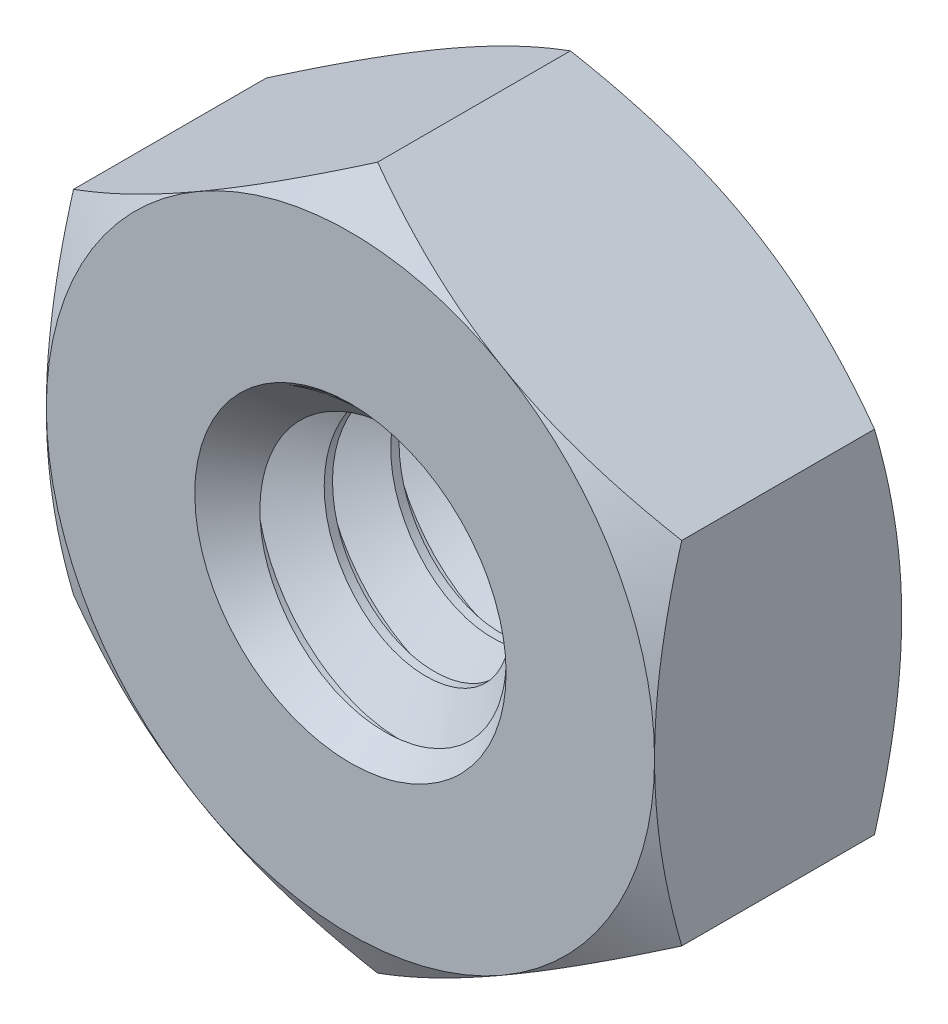
from build123d import *

# Parameters (mm, degrees)
BOSS_EXTRUDE1_DEPTH      = 0.65
BOSS_EXTRUDE1_DEPTH_BACK = 0.65
SKETCH2_R                = 0.8
SKETCH3_OUTSIDE_W        = 19.266
SKETCH3_OUTSIDE_H        = 19.762
SKETCH3_OUTSIDE_R        = 1.6
CUT_EXTRUDE1_DEPTH       = 3.768272626
CUT_EXTRUDE1_DRAFT       = -60
MIRROR1_COPY_1_SKETCH_W  = 19.266
MIRROR1_COPY_1_SKETCH_H  = 19.762
MIRROR1_COPY_1_SKETCH_R  = 1.6
MIRROR1_COPY_1_DEPTH     = 3.768272626
MIRROR1_COPY_1_DRAFT     = -60
SWEEP1_PITCH             = 0.35
SKETCH6_R                = 0.818944306
CUT_EXTRUDE2_DEPTH       = 3.955003784
SKETCH7_R                = 0.818944306
CUT_EXTRUDE3_DEPTH       = 3.768272731


with BuildPart() as part:
    # Sketch2 → Boss-Extrude1 (new, two sides: drawn at the far end of the back side and taken through both)
    with BuildSketch(Plane.XY.offset(-BOSS_EXTRUDE1_DEPTH_BACK)):
        Polygon((0, 1.847520861), (-1.6, 0.923760431), (-1.6, -0.923760431), (0, -1.847520861), (1.6, -0.923760431), (1.6, 0.923760431), align=None)
        Circle(SKETCH2_R, mode=Mode.SUBTRACT)
    extrude(amount=BOSS_EXTRUDE1_DEPTH + BOSS_EXTRUDE1_DEPTH_BACK)


with BuildPart() as cut_extrude1_tool:
    # Sketch3 outside → Cut-Extrude1 (with draft: the straight prism first)
    with BuildSketch(Plane.XY.offset(0.65)):
        Rectangle(SKETCH3_OUTSIDE_W, SKETCH3_OUTSIDE_H)
        Circle(SKETCH3_OUTSIDE_R, mode=Mode.SUBTRACT)
    extrude(amount=-CUT_EXTRUDE1_DEPTH)
    # Cut-Extrude1: the draft: its side faces are tilted about the plane it starts from
    cut_extrude1_sides = [cut_extrude1_tool.faces().sort_by_distance(p)[0] for p in [
        (0, -9.881, -1.234136313),
        (9.633, 0, -1.234136313),
        (0, 9.881, -1.234136313),
        (-9.633, 0, -1.234136313),
        (-1.6, 0, -1.234136313),
    ]]
    draft(cut_extrude1_sides, Plane.XY.offset(0.65), CUT_EXTRUDE1_DRAFT)


with BuildPart() as part_1:
    add(part.part)

    # Cut-Extrude1: cut by cut_extrude1_tool
    add(cut_extrude1_tool.part, mode=Mode.SUBTRACT)


with BuildPart() as mirror1_copy_1_tool:
    # Mirror1 copy 1 sketch → Mirror1 copy 1 (with draft: the straight prism first)
    with BuildSketch(Plane(origin=(0, 0, -0.65), x_dir=(1, 0, 0), z_dir=(0, 0, -1))):
        Rectangle(MIRROR1_COPY_1_SKETCH_W, MIRROR1_COPY_1_SKETCH_H)
        Circle(MIRROR1_COPY_1_SKETCH_R, mode=Mode.SUBTRACT)
    extrude(amount=-MIRROR1_COPY_1_DEPTH)
    # Mirror1 copy 1: the draft: its side faces are tilted about the plane it starts from
    mirror1_copy_1_sides = [mirror1_copy_1_tool.faces().sort_by_distance(p)[0] for p in [
        (0, -9.881, 1.234136313),
        (9.633, 0, 1.234136313),
        (0, 9.881, 1.234136313),
        (-9.633, 0, 1.234136313),
        (-1.6, 0, 1.234136313),
    ]]
    draft(mirror1_copy_1_sides, Plane(origin=(0, 0, -0.65), x_dir=(1, 0, 0), z_dir=(0, 0, -1)), MIRROR1_COPY_1_DRAFT)


with BuildPart() as part_2:
    add(part_1.part)

    # Mirror1 copy 1: cut by mirror1_copy_1_tool
    add(mirror1_copy_1_tool.part, mode=Mode.SUBTRACT)

    # Sweep1: the profile of Sketch4 screwed along a right-hand helix of 4.714286 turns, 6 arcs to a turn; built about Z, then put on its axis
    sweep1_z = Axis((0, 0, 0), (0, 0, 1))
    sweep1_corners = [(0.818944306, 0, -0.3171875), (0.572668332, 0, -0.175), (0.572668332, 0, -0.13125), (0.818944306, 0, 0.0109375)]
    with BuildLine(mode=Mode.PRIVATE) as sweep1_profile:
        Line(sweep1_corners[0], sweep1_corners[1])
        Line(sweep1_corners[1], sweep1_corners[2])
        Line(sweep1_corners[2], sweep1_corners[3])
        Line(sweep1_corners[3], sweep1_corners[0])
    sweep1_cap = Face(sweep1_profile.wire())
    sweep1_turn_angles = [0, 30, 60, 90, 120, 150, 180, 210, 240, 270, 300, 330, 360]
    sweep1_turn_weights = [1, 0.8660254037844387, 1, 0.8660254037844387, 1, 0.8660254037844387, 1, 0.8660254037844387, 1, 0.8660254037844387, 1, 0.8660254037844387, 1]
    sweep1_turn_rails = [Edge.make_bspline([Vector(p[0], p[1], 0).rotate(sweep1_z, sweep1_turn_angles[k]) / sweep1_turn_weights[k] + Vector(0, 0, p[2] + SWEEP1_PITCH * sweep1_turn_angles[k] / 360) for k in range(13)], [0, 0, 0, 1, 1, 2, 2, 3, 3, 4, 4, 5, 5, 6, 6, 6], 2, sweep1_turn_weights) for p in sweep1_corners]
    sweep1_turn_sides = [Face.make_surface_from_curves(sweep1_turn_rails[p[0]], sweep1_turn_rails[p[1]]) for p in [(0, 1), (1, 2), (2, 3), (3, 0)]]
    sweep1_last_angles = [1440, 1470, 1500, 1530, 1560, 1590, 1620, 1650, 1680, 1688.571428571, 1697.142857143]
    sweep1_last_weights = [1, 0.8660254037844387, 1, 0.8660254037844387, 1, 0.8660254037844387, 1, 0.8660254037844387, 1, 0.9888308262251224, 1]
    sweep1_last_rails = [Edge.make_bspline([Vector(p[0], p[1], 0).rotate(sweep1_z, sweep1_last_angles[k]) / sweep1_last_weights[k] + Vector(0, 0, p[2] + SWEEP1_PITCH * sweep1_last_angles[k] / 360) for k in range(11)], [0, 0, 0, 1, 1, 2, 2, 3, 3, 4, 4, 5, 5, 5], 2, sweep1_last_weights) for p in sweep1_corners]
    sweep1_last_sides = [Face.make_surface_from_curves(sweep1_last_rails[p[0]], sweep1_last_rails[p[1]]) for p in [(0, 1), (1, 2), (2, 3), (3, 0)]]
    sweep1 = Plane(origin=(0, 0, 0.65), x_dir=(0, 1, 0), z_dir=(0, 0, -1)) * Solid(Shell([*[p.moved(Location((0, 0, SWEEP1_PITCH * i))) for i in range(4) for p in sweep1_turn_sides], *sweep1_last_sides, sweep1_cap, sweep1_cap.rotate(sweep1_z, 1697.142857143).moved(Location((0, 0, SWEEP1_PITCH * 1697.142857143 / 360)))]))
    add(sweep1)

    # Sketch6 → Cut-Extrude2 (cut)
    with BuildSketch(Plane.XY.offset(0.65)):
        Circle(SKETCH6_R)
    extrude(amount=CUT_EXTRUDE2_DEPTH, mode=Mode.SUBTRACT)

    # Cut-Extrude2 cone 1 section (through the dimple's axis) → Cut-Extrude2 other way (revolve, cut)
    with BuildSketch(Plane(origin=(0, 0, 0.65), x_dir=(0, -1, 0), z_dir=(1, 0, 0))):
        Polygon((0, 0), (0.818944306, 0), (0, 0.818944306), align=None)
    revolve(axis=Axis((0, 0, 0.65), (0, 0, -1)), mode=Mode.SUBTRACT)

    # Sketch7 → Cut-Extrude3 (cut)
    with BuildSketch(Plane(origin=(0, 0, -0.65), x_dir=(-1, 0, 0), z_dir=(0, 0, -1))):
        Circle(SKETCH7_R)
    extrude(amount=CUT_EXTRUDE3_DEPTH, mode=Mode.SUBTRACT)

    # Cut-Extrude3 cone 1 section (through the dimple's axis) → Cut-Extrude3 other way (revolve, cut)
    with BuildSketch(Plane(origin=(0, 0, -0.65), x_dir=(0, 1, 0), z_dir=(1, 0, 0))):
        Polygon((0, 0), (0.818944306, 0), (0, 0.818944306), align=None)
    revolve(axis=Axis((0, 0, -0.65), (0, 0, 1)), mode=Mode.SUBTRACT)


solid = part_2.part
